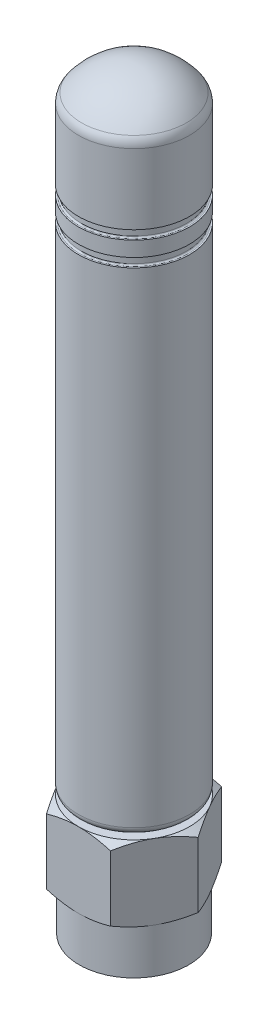
from build123d import *

# Parameters (mm, degrees)
BOSS_EXTRUDE1_DEPTH = 5
SKETCH4_R           = 2.8
CUT_EXTRUDE1_DEPTH  = 10.795066786
CUT_SWEEP1_PITCH    = 0.6
SKETCH8_R           = 2.2
CUT_EXTRUDE2_DEPTH  = 0.2
SKETCH9_R           = 0.3
BOSS_EXTRUDE2_DEPTH = 2
FILLET1_R           = 0.3
SKETCH10_W          = 3.7
SKETCH10_H          = 40
FILLET2_R           = 0.5
SKETCH11_W          = 0.772391992
SKETCH11_H          = 0.6
FILLET3_R           = 0.1
C_PULA1_FACE_RADIUS = 3.7
C_PULA1_HEIGHT      = 2
REDONDEO1_R         = 1


# Read off the part's stored shape, not the designer's step: Body-Move/Copy1
with BuildPart() as part:
    # Sketch1 → Revolve1 (revolve)
    with BuildSketch(Plane.XY, mode=Mode.PRIVATE) as revolve1_sk:
        Polygon((0, 8), (3.7, 8), (3.7, 3), (3.65, 3), (3.65, 0), (0, 0), align=None)
    revolve(revolve1_sk.sketch.rotate(Axis((0, 0, 0), (0, 1, 0)), 90), axis=Axis((0, 0, 0), (0, 1, 0)))

    # Sketch2 → Boss-Extrude1 (add)
    with BuildSketch(Plane(origin=(0, 8, 0), x_dir=(1, 0, 0), z_dir=(0, 1, 0))):
        Polygon((2.136195996, 3.7), (-2.136195996, 3.7), (-4.272391992, 0), (-2.136195996, -3.7), (2.136195996, -3.7), (4.272391992, 0), align=None)
    extrude(amount=-BOSS_EXTRUDE1_DEPTH)

    # Sketch3 → Cut-Revolve1 (revolve, cut)
    with BuildSketch(Plane(origin=(0, 0, 0), x_dir=(0, 0, -1), z_dir=(1, 0, 0))):
        Polygon((-7.770319398, 5.65), (-7.770319398, 8.028867513), (-3.65, 8.028867513), align=None)
        Polygon((-3.65, 2.971132487), (-7.770319398, 5.35), (-7.770319398, 2.971132487), align=None)
    revolve(axis=Axis((0, 8, 0), (0, -1, 0)), mode=Mode.SUBTRACT)

    # Sketch4 → Cut-Extrude1 (cut, through all)
    with BuildSketch(Plane.XZ):
        with Locations(Location((0, 0, 0), (0, 0, 270))):
            Circle(SKETCH4_R)
    extrude(amount=-CUT_EXTRUDE1_DEPTH, mode=Mode.SUBTRACT)

    # Cut-Sweep1: the profile of Sketch6 profile screwed along a right-hand helix of 15 turns, 6 arcs to a turn; built about Z, then put on its axis
    cut_sweep1_z = Axis((0, 0, 0), (0, 0, 1))
    cut_sweep1_corners = [(2.7997, 0, 0.00025), (2.7997, 0, -0.50025), (3.1, 0, -0.25)]
    with BuildLine(mode=Mode.PRIVATE) as cut_sweep1_profile:
        Line(cut_sweep1_corners[0], cut_sweep1_corners[1])
        Line(cut_sweep1_corners[1], cut_sweep1_corners[2])
        Line(cut_sweep1_corners[2], cut_sweep1_corners[0])
    cut_sweep1_cap = Face(cut_sweep1_profile.wire())
    cut_sweep1_turn_angles = [0, 30, 60, 90, 120, 150, 180, 210, 240, 270, 300, 330, 360]
    cut_sweep1_turn_weights = [1, 0.8660254037844387, 1, 0.8660254037844387, 1, 0.8660254037844387, 1, 0.8660254037844387, 1, 0.8660254037844387, 1, 0.8660254037844387, 1]
    cut_sweep1_turn_rails = [Edge.make_bspline([Vector(p[0], p[1], 0).rotate(cut_sweep1_z, cut_sweep1_turn_angles[k]) / cut_sweep1_turn_weights[k] + Vector(0, 0, p[2] + CUT_SWEEP1_PITCH * cut_sweep1_turn_angles[k] / 360) for k in range(13)], [0, 0, 0, 1, 1, 2, 2, 3, 3, 4, 4, 5, 5, 6, 6, 6], 2, cut_sweep1_turn_weights) for p in cut_sweep1_corners]
    cut_sweep1_turn_sides = [Face.make_surface_from_curves(cut_sweep1_turn_rails[p[0]], cut_sweep1_turn_rails[p[1]]) for p in [(0, 1), (1, 2), (2, 0)]]
    cut_sweep1 = Plane(origin=(0, 0, 0), x_dir=(0, 0, -1), z_dir=(0, 1, 0)) * Solid(Shell([*[p.moved(Location((0, 0, CUT_SWEEP1_PITCH * i))) for i in range(15) for p in cut_sweep1_turn_sides], cut_sweep1_cap, cut_sweep1_cap.rotate(cut_sweep1_z, 5400).moved(Location((0, 0, CUT_SWEEP1_PITCH * 5400 / 360)))]))
    add(cut_sweep1, mode=Mode.SUBTRACT)


with BuildPart() as body_2:
    # Sketch7 → Revolve3 (revolve)
    with BuildSketch(Plane.XY, mode=Mode.PRIVATE) as revolve3_sk:
        Polygon((-2.5, 11.4), (-2.5, 9.6), (-2.85, 9.6), (-2.85, 4.8), (-2.3, 4.8), (-2.3, 2.8), (0, 2.8), (0, 11.4), align=None)
    revolve(revolve3_sk.sketch.rotate(Axis((0, 2.8, 0), (0, 1, 0)), 270), axis=Axis((0, 2.8, 0), (0, 1, 0)))

    # Sketch8 → Cut-Extrude2 (cut)
    with BuildSketch(Plane.XZ.offset(-2.8)):
        with Locations(Location((0, 0, 0), (0, 0, 270))):
            Circle(SKETCH8_R)
    extrude(amount=-CUT_EXTRUDE2_DEPTH, mode=Mode.SUBTRACT)

    # Sketch9 → Boss-Extrude2 (add)
    with BuildSketch(Plane.XZ.offset(-3)):
        with Locations(Location((0, 0, 0), (0, 0, 270))):
            Circle(SKETCH9_R)
    extrude(amount=BOSS_EXTRUDE2_DEPTH)

    # Fillet1
    fillet1_edges = [body_2.edges().sort_by_distance(p)[0] for p in [
        (0, 1, 0.3),
    ]]
    fillet(fillet1_edges, radius=FILLET1_R)


with BuildPart() as body_3:
    # Body-Move/Copy1 outline → Body-Move/Copy1 (revolve)
    with BuildSketch(Plane.XY):
        with BuildLine():
            Line((0, 11.4), (0, 1))
            ThreePointArc((0, 1), (0.212132034, 1.087867966), (0.3, 1.3))
            Line((0.3, 1.3), (0.3, 3))
            Line((0.3, 3), (2.2, 3))
            Line((2.2, 3), (2.2, 2.8))
            Line((2.2, 2.8), (2.3, 2.8))
            Line((2.3, 2.8), (2.3, 4.8))
            Line((2.3, 4.8), (2.85, 4.8))
            Line((2.85, 4.8), (2.85, 9.6))
            Line((2.85, 9.6), (2.5, 9.6))
            Line((2.5, 9.6), (2.5, 11.4))
            Line((2.5, 11.4), (0, 11.4))
        make_face()
    revolve(axis=Axis((0, 0, 0), (0, 1, 0)))


with BuildPart() as part_1:
    add(part.part)

    # Combine1: cut body 3
    add(body_3.part, mode=Mode.SUBTRACT)


with BuildPart() as body_3_2:
    # Sketch10 → Revolve4 (revolve)
    with BuildSketch(Plane.XY, mode=Mode.PRIVATE) as revolve4_sk:
        with Locations((-1.85, 28.2)):
            Rectangle(SKETCH10_W, SKETCH10_H)
    revolve(revolve4_sk.sketch.rotate(Axis((0, 8.2, 0), (0, 1, 0)), 90), axis=Axis((0, 8.2, 0), (0, 1, 0)))

    # Fillet2
    fillet2_edges = [body_3_2.edges().sort_by_distance(p)[0] for p in [
        (0, 8.2, -3.7),
    ]]
    fillet(fillet2_edges, radius=FILLET2_R)

    # Sketch11 → Cut-Revolve2 (revolve, cut)
    with BuildSketch(Plane.XY):
        with Locations((-3.886195996, 42.9)):
            Rectangle(SKETCH11_W, SKETCH11_H)
        with Locations((-3.886195996, 41.3)):
            Rectangle(SKETCH11_W, SKETCH11_H)
    revolve(axis=Axis((0, 48.2, 0), (0, -1, 0)), mode=Mode.SUBTRACT)

    # Fillet3
    fillet3_edges = [body_3_2.edges().sort_by_distance(p)[0] for p in [
        (3.5, 42.6, 0),
        (3.5, 43.2, 0),
        (3.5, 41, 0),
        (3.5, 41.6, 0),
    ]]
    fillet(fillet3_edges, radius=FILLET3_R)

    # Cúpula1: a dome of height H over a round flat face of radius A is a cap of a sphere of radius (A * A + H * H) / (2 * H)
    c_pula1_r = (C_PULA1_FACE_RADIUS * C_PULA1_FACE_RADIUS + C_PULA1_HEIGHT * C_PULA1_HEIGHT) / (2 * C_PULA1_HEIGHT)
    c_pula1_base = Plane((0, 48.2, 0), z_dir=(0, 1, 0))
    with Locations(c_pula1_base.offset(C_PULA1_HEIGHT - c_pula1_r)):
        c_pula1_ball = Sphere(c_pula1_r, mode=Mode.PRIVATE)
    add(split(c_pula1_ball, bisect_by=c_pula1_base, keep=Keep.TOP, mode=Mode.PRIVATE))

    # Redondeo1
    redondeo1_edges = [body_3_2.edges().sort_by_distance(p)[0] for p in [
        (0, 48.2, -3.7),
    ]]
    fillet(redondeo1_edges, radius=REDONDEO1_R)


solid = Compound([body_2.part, part_1.part, body_3_2.part])
